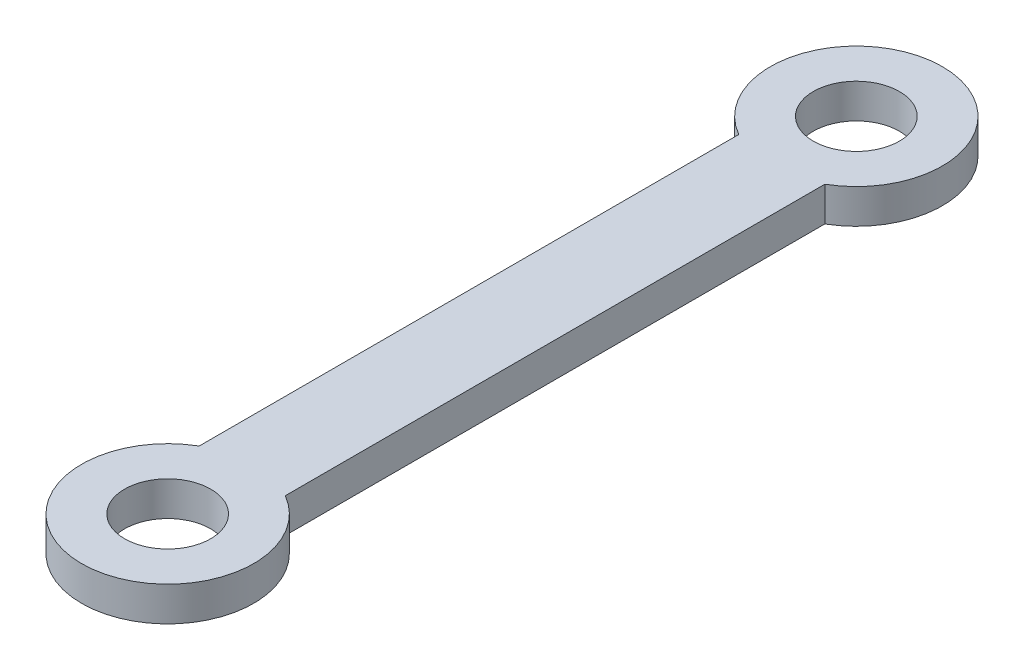
from build123d import *

# Parameters (mm, degrees)
SKETCH1_R           = 3.175
BOSS_EXTRUDE1_DEPTH = 2.54


with BuildPart() as part:
    # Sketch1 → Boss-Extrude1 (new body)
    with BuildSketch(Plane(origin=(0, 0, 0), x_dir=(1, 0, 0), z_dir=(0, 1, 0))):
        with BuildLine():
            Line((-3.175, 45.300738686), (-3.175, 5.499261314))
            ThreePointArc((-3.175, 5.499261314), (0, -6.35), (3.175, 5.499261314))
            Line((3.175, 5.499261314), (3.175, 45.300738686))
            ThreePointArc((3.175, 45.300738686), (0, 57.15), (-3.175, 45.300738686))
        make_face()
        Circle(SKETCH1_R, mode=Mode.SUBTRACT)
        with Locations((0, 50.8)):
            Circle(SKETCH1_R, mode=Mode.SUBTRACT)
    extrude(amount=BOSS_EXTRUDE1_DEPTH)


solid = part.part
